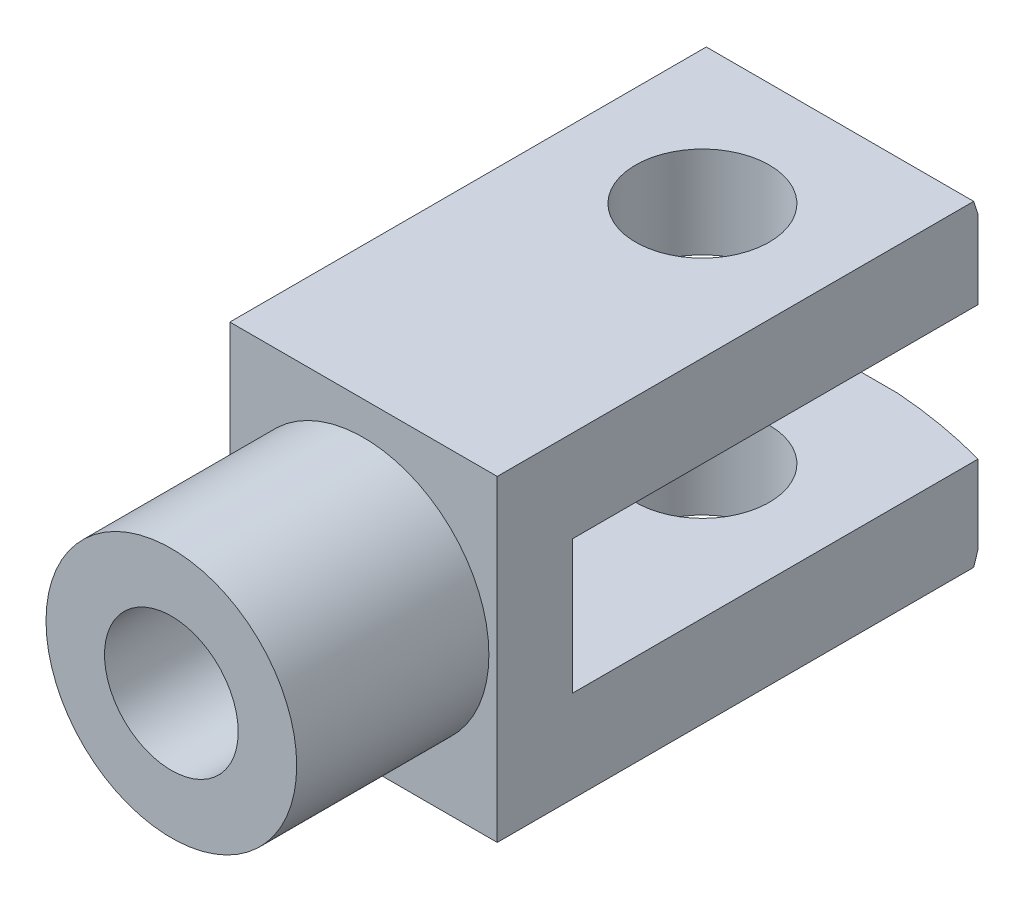
from build123d import *

# Parameters (mm, degrees)
CROQUIS3_W            = 139.658435228
CROQUIS3_H            = 16
CORTAR_EXTRUIR1_DEPTH = 51
CROQUIS4_OUTSIDE_W    = 126.9
CROQUIS4_OUTSIDE_H    = 126.9
CROQUIS4_OUTSIDE_W_2  = 120.050230854
CROQUIS4_OUTSIDE_H_2  = 37.93587295
CORTAR_EXTRUIR2_DEPTH = 107.175895765
CROQUIS5_OUTSIDE_W    = 121.792
CROQUIS5_OUTSIDE_H    = 66.086
CROQUIS5_OUTSIDE_W_2  = 32
CROQUIS5_OUTSIDE_H_2  = 52.876669862
CORTAR_EXTRUIR4_DEPTH = 98.164515307
CROQUIS6_OUTSIDE_W    = 53.342
CROQUIS6_OUTSIDE_H    = 104.342
CROQUIS6_OUTSIDE_R    = 59.713814124
CORTAR_EXTRUIR5_DEPTH = 51
CORTAR_EXTRUIR6_START = -32
CORTAR_EXTRUIR6_DEPTH = 33
CROQUIS8_R            = 8
CORTAR_EXTRUIR7_DEPTH = 65.928309429
CROQUIS9_R            = 8
CORTAR_EXTRUIR8_DEPTH = 51


with BuildPart() as part:
    # Croquis1 → Revolución2 (revolve)
    with BuildSketch(Plane(origin=(0, 0, 0), x_dir=(1, 0, 0), z_dir=(0, 1, 0)), mode=Mode.PRIVATE) as revoluci_n2_sk:
        Polygon((15, -50.205128205), (0, -50.205128205), (0, -18.205128205), (8, -18.205128205), (8, 32.794871795), (46.820512821, 32.794871795), (46.820512821, -27.205128205), (15, -27.205128205), align=None)
    revolve(revoluci_n2_sk.sketch.rotate(Axis((0, 0, -124.102564103), (0, 0, 1)), 180), axis=Axis((0, 0, -124.102564103), (0, 0, 1)))

    # Croquis3 → Cortar-Extruir1 (cut)
    with BuildSketch(Plane(origin=(0, 0, -32.794871795), x_dir=(-1, 0, 0), z_dir=(0, 0, -1))):
        Rectangle(CROQUIS3_W, CROQUIS3_H)
    extrude(amount=-CORTAR_EXTRUIR1_DEPTH, mode=Mode.SUBTRACT)

    # Croquis4 outside → Cortar-Extruir2 (cut, through all)
    with BuildSketch(Plane(origin=(0, 0, -32.794871795), x_dir=(-1, 0, 0), z_dir=(0, 0, -1))):
        Rectangle(CROQUIS4_OUTSIDE_W, CROQUIS4_OUTSIDE_H)
        Rectangle(CROQUIS4_OUTSIDE_W_2, CROQUIS4_OUTSIDE_H_2, mode=Mode.SUBTRACT)
    extrude(amount=-CORTAR_EXTRUIR2_DEPTH, mode=Mode.SUBTRACT)

    # Croquis5 outside → Cortar-Extruir4 (cut, through all)
    with BuildSketch(Plane(origin=(0, 0, -32.794871795), x_dir=(-1, 0, 0), z_dir=(0, 0, -1))):
        Rectangle(CROQUIS5_OUTSIDE_W, CROQUIS5_OUTSIDE_H)
        Rectangle(CROQUIS5_OUTSIDE_W_2, CROQUIS5_OUTSIDE_H_2, mode=Mode.SUBTRACT)
    extrude(amount=-CORTAR_EXTRUIR4_DEPTH, mode=Mode.SUBTRACT)

    # Croquis6 outside → Cortar-Extruir5 (cut)
    with BuildSketch(Plane(origin=(0, 18.967936475, 0), x_dir=(1, 0, 0), z_dir=(0, 1, 0))):
        with Locations((0, -8.705)):
            Rectangle(CROQUIS6_OUTSIDE_W, CROQUIS6_OUTSIDE_H)
        with Locations((0, -27.205128205)):
            Circle(CROQUIS6_OUTSIDE_R, mode=Mode.SUBTRACT)
    extrude(amount=-CORTAR_EXTRUIR5_DEPTH, mode=Mode.SUBTRACT)


with BuildPart() as cortar_extruir5_kept_piece:
    # of the separate pieces the step leaves, the one the design keeps (cortar_extruir5_pieces_kept)
    add(part.part.solids().sort_by_distance((-15, 0, 50.205128205))[0])

    # Cortar-Extruir6: read off the stored shape, not the designer's step
    # Cortar-Extruir6 outline → Cortar-Extruir6 (cut)
    with BuildSketch(Plane(origin=(16, 0, 0), x_dir=(0, 0, -1), z_dir=(1, 0, 0)).offset(CORTAR_EXTRUIR6_START)):
        with BuildLine():
            ThreePointArc((29.810017934, 18.967936475), (31.336160338, 13.54352388), (32.347449433, 8))
            Line((32.347449433, 8), (33.422130035, 0))
            Line((33.422130035, 0), (34, 4.301705749))
            Line((34, 4.301705749), (34, 20))
            Line((34, 20), (29.466668549, 20))
            Line((29.466668549, 20), (29.810017934, 18.967936475))
        make_face()
        with BuildLine():
            Line((34, -4.301705749), (33.422130035, 0))
            Line((33.422130035, 0), (32.347449433, -8))
            ThreePointArc((32.347449433, -8), (31.336160338, -13.54352388), (29.810017934, -18.967936475))
            Line((29.810017934, -18.967936475), (29.466668549, -20))
            Line((29.466668549, -20), (34, -20))
            Line((34, -20), (34, -4.301705749))
        make_face()
    extrude(amount=CORTAR_EXTRUIR6_DEPTH, mode=Mode.SUBTRACT)

    # Croquis8 → Cortar-Extruir7 (cut, through all)
    with BuildSketch(Plane.XZ.offset(18.967936475)):
        with Locations(Location((0, -13.347449433, 0), (0, 0, 270))):
            Circle(CROQUIS8_R)
    extrude(amount=-CORTAR_EXTRUIR7_DEPTH, mode=Mode.SUBTRACT)

    # Croquis9 → Cortar-Extruir8 (cut)
    with BuildSketch(Plane.XY.offset(50.205128205)):
        Circle(CROQUIS9_R)
    extrude(amount=-CORTAR_EXTRUIR8_DEPTH, mode=Mode.SUBTRACT)


solid = cortar_extruir5_kept_piece.part
